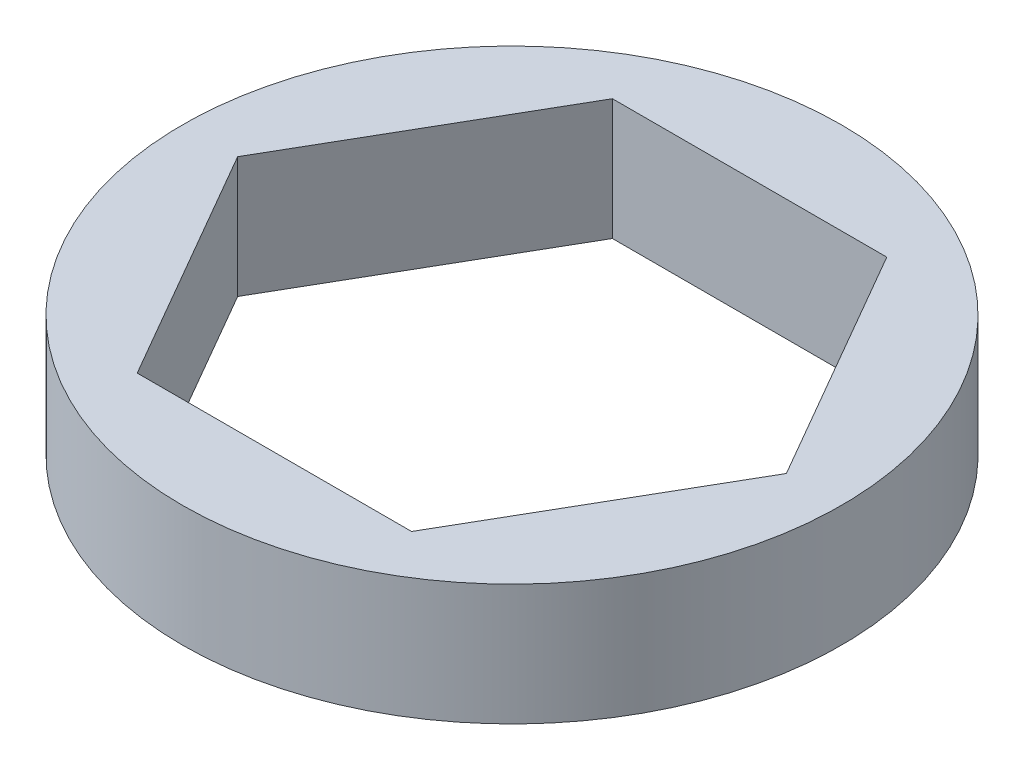
from build123d import *

# Parameters (mm, degrees)
SKETCH1_R           = 6.429375
BOSS_EXTRUDE1_DEPTH = 1.1811


with BuildPart() as part:
    # Sketch1 → Boss-Extrude1 (new, symmetric)
    with BuildSketch(Plane(origin=(0, 0, 0), x_dir=(1, 0, 0), z_dir=(0, 1, 0))):
        Circle(SKETCH1_R)
        Polygon((2.676307173, -4.6355), (5.352614346, 0), (2.676307173, 4.6355), (-2.676307173, 4.6355), (-5.352614346, 0), (-2.676307173, -4.6355), align=None, mode=Mode.SUBTRACT)
    extrude(amount=BOSS_EXTRUDE1_DEPTH, both=True)


solid = part.part
